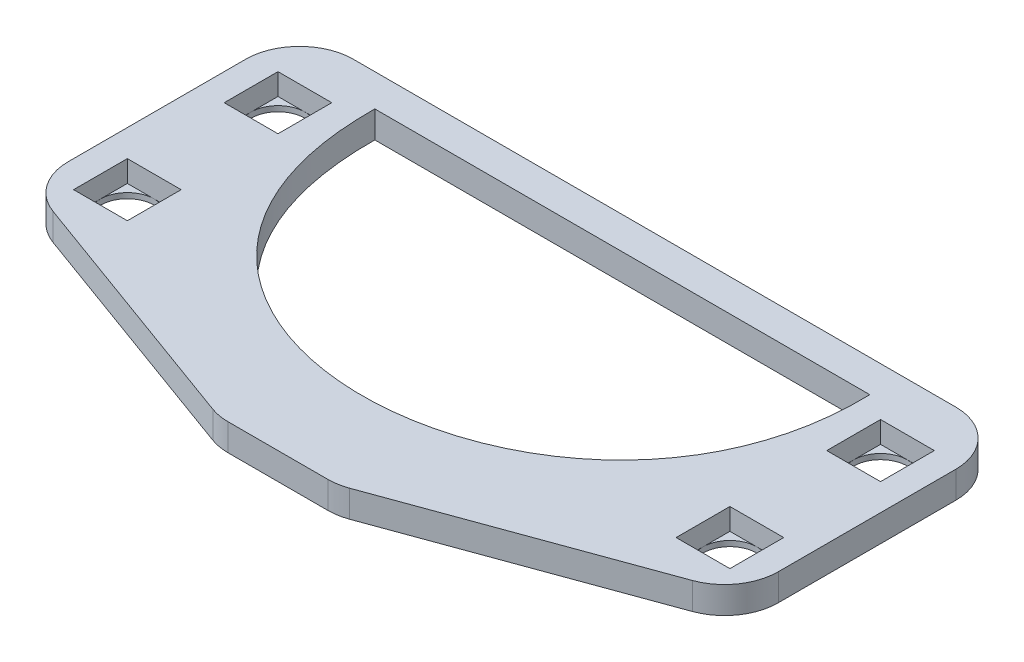
from build123d import *
from OCP.BRepFilletAPI import BRepFilletAPI_MakeChamfer

# Parameters (mm, degrees)
SKETCH1_W           = 66
SKETCH1_H           = 35
BOSS_EXTRUDE1_DEPTH = 2.5
SKETCH2_R           = 2.5
CUT_EXTRUDE1_DEPTH  = 75.74790967
CUT_EXTRUDE2_DEPTH  = 2
CHAMFER1_SIZE       = 10
CHAMFER1_SIZE2      = 27.474774195
FILLET1_R           = 5


with BuildPart() as part:
    # Sketch1 → Boss-Extrude1 (new body)
    with BuildSketch(Plane(origin=(0, 0, 0), x_dir=(1, 0, 0), z_dir=(0, 1, 0))):
        with Locations((33, 17.5)):
            Rectangle(SKETCH1_W, SKETCH1_H)
    extrude(amount=BOSS_EXTRUDE1_DEPTH)

    # Sketch2 → Cut-Extrude1 (cut, through all)
    with BuildSketch(Plane(origin=(0, 2.5, 0), x_dir=(1, 0, 0), z_dir=(0, 1, 0))):
        with BuildLine():
            Line((56, 32), (10, 32))
            add(Edge.make_bspline(
                [(56, 32), (56.835772177, 1.668921889), (9.621445729, -0.767580045), (10, 32)],
                knots=[0, 0, 0, 0, 1, 1, 1, 1], degree=3))
        make_face()
        with Locations((5, 28)):
            Circle(SKETCH2_R)
        with Locations((5, 14)):
            Circle(SKETCH2_R)
        with Locations((61, 14)):
            Circle(SKETCH2_R)
        with Locations((61, 28)):
            Circle(SKETCH2_R)
    extrude(amount=-CUT_EXTRUDE1_DEPTH, mode=Mode.SUBTRACT)

    # Sketch2<3> → Cut-Extrude2 (cut)
    with BuildSketch(Plane(origin=(0, 2.5, 0), x_dir=(1, 0, 0), z_dir=(0, 1, 0))):
        with BuildLine():
            Line((7.5, 28), (7.5, 30.5))
            Line((7.5, 30.5), (5, 30.5))
            ThreePointArc((5, 30.5), (6.767766953, 29.767766953), (7.5, 28))
        make_face()
        with BuildLine():
            ThreePointArc((2.5, 27.999999992), (3.232233044, 29.76776695), (5, 30.5))
            Line((5, 30.5), (2.5, 30.5))
            Line((2.5, 30.5), (2.5, 27.999999992))
        make_face()
        with BuildLine():
            Line((7.5, 25.5), (7.5, 28))
            ThreePointArc((7.5, 28), (6.767766953, 26.232233047), (5, 25.5))
            Line((5, 25.5), (7.5, 25.5))
        make_face()
        with BuildLine():
            ThreePointArc((5, 25.5), (3.23223305, 26.232233044), (2.5, 27.999999992))
            Line((2.5, 27.999999992), (2.5, 25.5))
            Line((2.5, 25.5), (5, 25.5))
        make_face()
        with BuildLine():
            Line((7.5, 14), (7.5, 16.5))
            Line((7.5, 16.5), (5, 16.5))
            ThreePointArc((5, 16.5), (6.767766953, 15.767766953), (7.5, 14))
        make_face()
        with BuildLine():
            ThreePointArc((2.5, 14), (3.232233047, 15.767766953), (5, 16.5))
            Line((5, 16.5), (2.5, 16.5))
            Line((2.5, 16.5), (2.5, 14))
        make_face()
        with BuildLine():
            Line((7.5, 11.5), (7.5, 14))
            ThreePointArc((7.5, 14), (6.767766953, 12.232233047), (5, 11.5))
            Line((5, 11.5), (7.5, 11.5))
        make_face()
        with BuildLine():
            ThreePointArc((5, 11.5), (3.232233047, 12.232233047), (2.5, 14))
            Line((2.5, 14), (2.5, 11.5))
            Line((2.5, 11.5), (5, 11.5))
        make_face()
        with BuildLine():
            Line((61, 16.5), (58.5, 16.5))
            Line((58.5, 16.5), (58.5, 14))
            ThreePointArc((58.5, 14), (59.232233047, 15.767766953), (61, 16.5))
        make_face()
        with BuildLine():
            Line((63.5, 16.5), (61, 16.5))
            ThreePointArc((61, 16.5), (62.767766953, 15.767766953), (63.5, 14))
            Line((63.5, 14), (63.5, 16.5))
        make_face()
        with BuildLine():
            ThreePointArc((61, 11.5), (59.232233047, 12.232233047), (58.5, 14))
            Line((58.5, 14), (58.5, 11.5))
            Line((58.5, 11.5), (61, 11.5))
        make_face()
        with BuildLine():
            Line((63.5, 11.5), (63.5, 14))
            ThreePointArc((63.5, 14), (62.767766953, 12.232233047), (61, 11.5))
            Line((61, 11.5), (63.5, 11.5))
        make_face()
        with BuildLine():
            Line((61, 30.5), (58.5, 30.5))
            Line((58.5, 30.5), (58.5, 28))
            ThreePointArc((58.5, 28), (59.232233047, 29.767766953), (61, 30.5))
        make_face()
        with BuildLine():
            Line((63.5, 30.5), (61, 30.5))
            ThreePointArc((61, 30.5), (62.767766953, 29.767766953), (63.5, 28))
            Line((63.5, 28), (63.5, 30.5))
        make_face()
        with BuildLine():
            ThreePointArc((61, 25.5), (59.232233047, 26.232233047), (58.5, 28))
            Line((58.5, 28), (58.5, 25.5))
            Line((58.5, 25.5), (61, 25.5))
        make_face()
        with BuildLine():
            Line((63.5, 25.5), (63.5, 28))
            ThreePointArc((63.5, 28), (62.767766953, 26.232233047), (61, 25.5))
            Line((61, 25.5), (63.5, 25.5))
        make_face()
    extrude(amount=-CUT_EXTRUDE2_DEPTH, mode=Mode.SUBTRACT)

    # Chamfer1: one chamfer whose edges measure the first distance from different faces: ONE call of the kernel's chamfer builder (chamfer() names one face for all edges)
    chamfer1_edges_1 = [part.edges().sort_by_distance(p)[0] for p in [
        (66, 1.25, 0),
    ]]
    chamfer1_side_1 = [part.faces().sort_by_distance(p)[0] for p in [
        (66, 1.25, -17.5),
    ]]
    chamfer1_edges_2 = [part.edges().sort_by_distance(p)[0] for p in [
        (0, 1.25, 0),
    ]]
    chamfer1_side_2 = [part.faces().sort_by_distance(p)[0] for p in [
        (0, 1.25, -17.5),
    ]]
    chamfer1 = BRepFilletAPI_MakeChamfer(part.part.solid().wrapped)
    for e in chamfer1_edges_1:
        chamfer1.Add(CHAMFER1_SIZE, CHAMFER1_SIZE2, e.wrapped, chamfer1_side_1[0].wrapped)  # the first distance lies on this face
    for e in chamfer1_edges_2:
        chamfer1.Add(CHAMFER1_SIZE, CHAMFER1_SIZE2, e.wrapped, chamfer1_side_2[0].wrapped)  # the first distance lies on this face
    add(Compound.cast(chamfer1.Shape()), mode=Mode.REPLACE)

    # Fillet1
    fillet1_edges = [part.edges().sort_by_distance(p)[0] for p in [
        (27.474774195, 1.25, 0),
        (38.525225805, 1.25, 0),
        (66, 1.25, -10),
        (66, 1.25, -35),
        (0, 1.25, -35),
        (0, 1.25, -10),
    ]]
    fillet(fillet1_edges, radius=FILLET1_R)


solid = part.part
